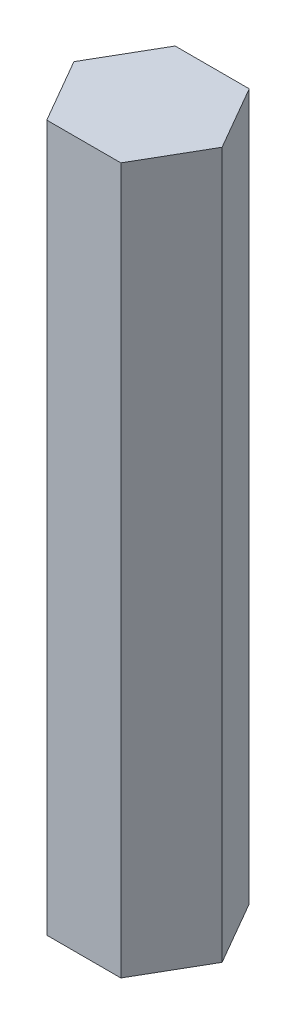
from build123d import *

# Parameters (mm, degrees)
BOSS_EXTRUDE1_DEPTH = 69.85


with BuildPart() as part:
    # Sketch1 → Boss-Extrude1 (new body)
    with BuildSketch(Plane(origin=(0, 0, 0), x_dir=(1, 0, 0), z_dir=(0, 1, 0))):
        Polygon((7.332348419, 0), (3.666174209, 6.35), (-3.666174209, 6.35), (-7.332348419, 0), (-3.666174209, -6.35), (3.666174209, -6.35), align=None)
    extrude(amount=BOSS_EXTRUDE1_DEPTH)


solid = part.part
